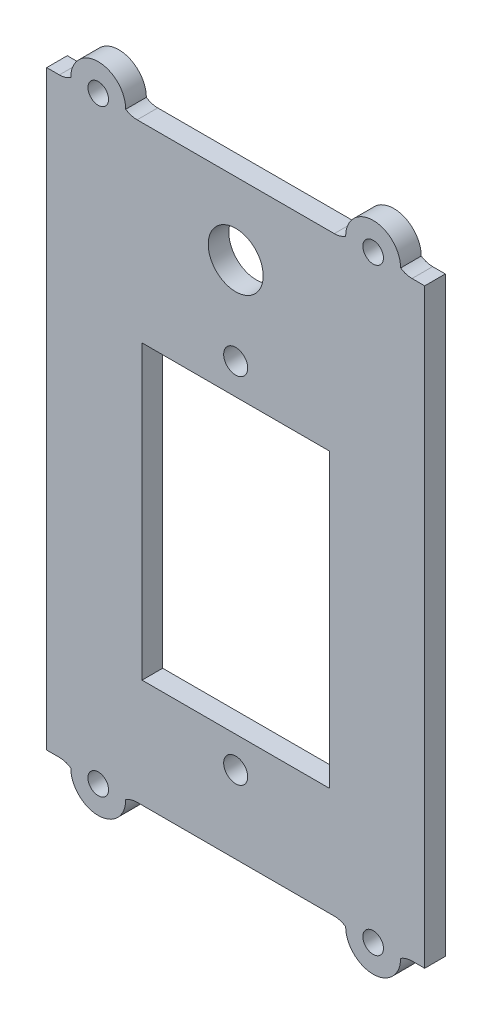
from build123d import *

# Parameters (mm, degrees)
SKETCH1_R           = 1.5
BOSS_EXTRUDE1_DEPTH = 3
SKETCH2_R           = 4
SKETCH2_R_2         = 1.75
SKETCH2_W           = 27.25
SKETCH2_H           = 42.5
CUT_EXTRUDE1_DEPTH  = 55.968172609


with BuildPart() as part:
    # Sketch1 → Boss-Extrude1 (new body)
    with BuildSketch(Plane.XY):
        with BuildLine():
            Line((10.658312395, 43), (-10.658312395, 43))
            Line((-10.658312395, 43), (-14.341687605, 43))
            ThreePointArc((-14.341687605, 43), (-15.207713009, 43.127718677), (-16, 43.5))
            ThreePointArc((-16, 43.5), (-20, 47.5), (-24, 43.5))
            ThreePointArc((-24, 43.5), (-24.792286991, 43.127718677), (-25.658312395, 43))
            Line((-25.658312395, 43), (-27.5, 43))
            Line((-27.5, 43), (-27.5, -43))
            Line((-27.5, -43), (-25.658312395, -43))
            ThreePointArc((-25.658312395, -43), (-24.792286991, -43.127718677), (-24, -43.5))
            ThreePointArc((-24, -43.5), (-20, -47.5), (-16, -43.5))
            ThreePointArc((-16, -43.5), (-15.207713009, -43.127718677), (-14.341687605, -43))
            Line((-14.341687605, -43), (-10.658312395, -43))
            Line((-10.658312395, -43), (10.658312395, -43))
            Line((10.658312395, -43), (14.341687605, -43))
            ThreePointArc((14.341687605, -43), (15.207713009, -43.127718677), (16, -43.5))
            ThreePointArc((16, -43.5), (20, -47.5), (24, -43.5))
            ThreePointArc((24, -43.5), (24.792286991, -43.127718677), (25.658312395, -43))
            Line((25.658312395, -43), (27.5, -43))
            Line((27.5, -43), (27.5, 43))
            Line((27.5, 43), (25.658312395, 43))
            ThreePointArc((25.658312395, 43), (24.792286991, 43.127718677), (24, 43.5))
            ThreePointArc((24, 43.5), (20, 47.5), (16, 43.5))
            ThreePointArc((16, 43.5), (15.207713009, 43.127718677), (14.341687605, 43))
            Line((14.341687605, 43), (10.658312395, 43))
        make_face()
        with Locations((-20, -43.5)):
            Circle(SKETCH1_R, mode=Mode.SUBTRACT)
        with Locations((20, -43.5)):
            Circle(SKETCH1_R, mode=Mode.SUBTRACT)
        with Locations((-20, 43.5)):
            Circle(SKETCH1_R, mode=Mode.SUBTRACT)
        with Locations((20, 43.5)):
            Circle(SKETCH1_R, mode=Mode.SUBTRACT)
    extrude(amount=BOSS_EXTRUDE1_DEPTH)

    # Sketch2 → Cut-Extrude1 (cut, through all)
    with BuildSketch(Plane.XY):
        with Locations((0, 32.5)):
            Circle(SKETCH2_R)
        with Locations((0, 19.75)):
            Circle(SKETCH2_R_2)
        with Locations((0, -31.75)):
            Circle(SKETCH2_R_2)
        with Locations((0, -6)):
            Rectangle(SKETCH2_W, SKETCH2_H)
    extrude(amount=CUT_EXTRUDE1_DEPTH, mode=Mode.SUBTRACT)


solid = part.part
